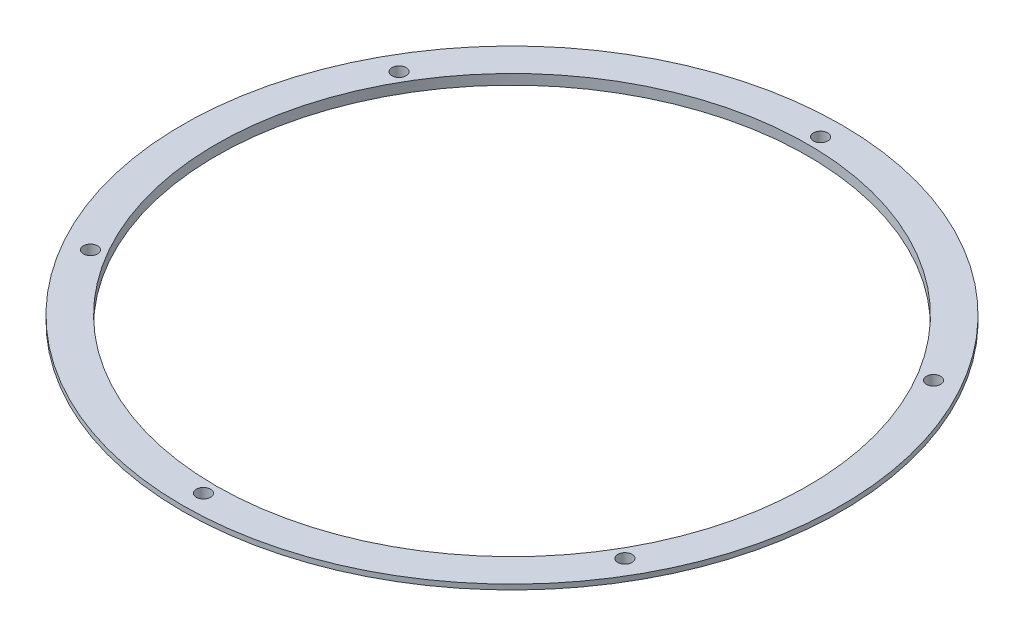
from build123d import *

# Parameters (mm, degrees)
SKETCH1_R           = 160.85
SKETCH1_R_2         = 3.556
SKETCH1_R_3         = 148.15
BOSS_EXTRUDE1_DEPTH = 5.08
BOSS_EXTRUDE2_START = -2.54
SKETCH2_R           = 165
SKETCH2_R_2         = 160.85
BOSS_EXTRUDE2_DEPTH = 2.54


with BuildPart() as part:
    # Sketch1 → Boss-Extrude1 (new body)
    with BuildSketch(Plane(origin=(0, 0, 0), x_dir=(1, 0, 0), z_dir=(0, 1, 0))):
        Circle(SKETCH1_R)
        with Locations((0, 154.5)):
            Circle(SKETCH1_R_2, mode=Mode.SUBTRACT)
        with Locations((133.800924885, 77.25)):
            Circle(SKETCH1_R_2, mode=Mode.SUBTRACT)
        with Locations((133.800924885, -77.25)):
            Circle(SKETCH1_R_2, mode=Mode.SUBTRACT)
        with Locations((0, -154.5)):
            Circle(SKETCH1_R_2, mode=Mode.SUBTRACT)
        with Locations((-133.800924885, -77.25)):
            Circle(SKETCH1_R_2, mode=Mode.SUBTRACT)
        with Locations((-133.800924885, 77.25)):
            Circle(SKETCH1_R_2, mode=Mode.SUBTRACT)
        Circle(SKETCH1_R_3, mode=Mode.SUBTRACT)
    extrude(amount=BOSS_EXTRUDE1_DEPTH)

    # Sketch2 → Boss-Extrude2 (add)
    with BuildSketch(Plane(origin=(0, 5.08, 0), x_dir=(1, 0, 0), z_dir=(0, 1, 0)).offset(BOSS_EXTRUDE2_START)):
        Circle(SKETCH2_R)
        Circle(SKETCH2_R_2, mode=Mode.SUBTRACT)
    extrude(amount=BOSS_EXTRUDE2_DEPTH)


solid = part.part
